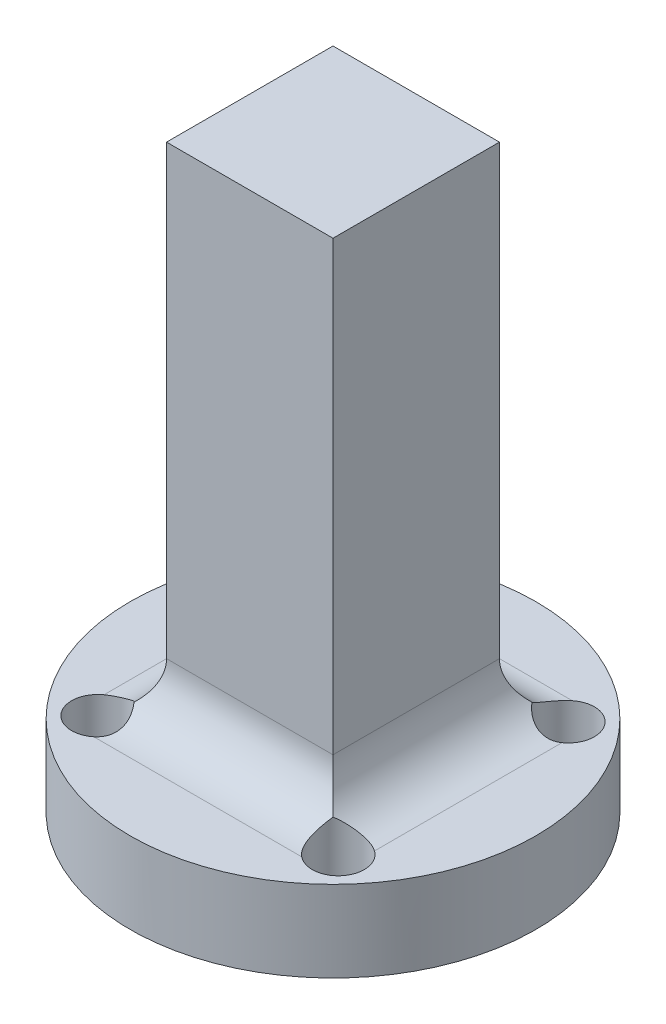
from build123d import *

# Parameters (mm, degrees)
SKETCH1_R           = 9.75
SKETCH1_R_2         = 1.25
BOSS_EXTRUDE2_DEPTH = 2
SKETCH2_W           = 8
SKETCH2_H           = 8
BOSS_EXTRUDE3_DEPTH = 24
BOSS_EXTRUDE5_START = 1.9
SKETCH7_R           = 9.75
SKETCH7_R_2         = 4.5
SKETCH7_R_3         = 1.25
BOSS_EXTRUDE5_DEPTH = 1.9
FILLET1_R           = 2.5


with BuildPart() as part:
    # Sketch1 → Boss-Extrude2 (new body)
    with BuildSketch(Plane(origin=(0, 0, 0), x_dir=(1, 0, 0), z_dir=(0, 1, 0))):
        with Locations(Location((0, 0, 0), (0, 0, 270))):
            Circle(SKETCH1_R)
        with Locations(Location((-5.78230038, 5.52856241, 0), (0, 0, 270))):
            Circle(SKETCH1_R_2, mode=Mode.SUBTRACT)
        with Locations(Location((-5.78230038, -5.52856241, 0), (0, 0, 270))):
            Circle(SKETCH1_R_2, mode=Mode.SUBTRACT)
        with Locations(Location((5.78230038, -5.52856241, 0), (0, 0, 270))):
            Circle(SKETCH1_R_2, mode=Mode.SUBTRACT)
        with Locations(Location((5.78230038, 5.52856241, 0), (0, 0, 270))):
            Circle(SKETCH1_R_2, mode=Mode.SUBTRACT)
    extrude(amount=BOSS_EXTRUDE2_DEPTH)

    # Sketch2 → Boss-Extrude3 (add)
    with BuildSketch(Plane(origin=(0, 2, 0), x_dir=(1, 0, 0), z_dir=(0, 1, 0))):
        Rectangle(SKETCH2_W, SKETCH2_H)
    extrude(amount=BOSS_EXTRUDE3_DEPTH)

    # Sketch7 → Boss-Extrude5 (add)
    with BuildSketch(Plane.XZ.offset(BOSS_EXTRUDE5_START)):
        with Locations(Location((0, 0, 0), (0, 0, 270))):
            Circle(SKETCH7_R)
        with Locations(Location((0, 0, 0), (0, 0, 90))):
            Circle(SKETCH7_R_2, mode=Mode.SUBTRACT)
        with Locations(Location((-5.78230038, 5.52856241, 0), (0, 0, 270))):
            Circle(SKETCH7_R_3, mode=Mode.SUBTRACT)
        with Locations(Location((5.78230038, 5.52856241, 0), (0, 0, 270))):
            Circle(SKETCH7_R_3, mode=Mode.SUBTRACT)
        with Locations(Location((5.78230038, -5.52856241, 0), (0, 0, 270))):
            Circle(SKETCH7_R_3, mode=Mode.SUBTRACT)
        with Locations(Location((-5.78230038, -5.52856241, 0), (0, 0, 270))):
            Circle(SKETCH7_R_3, mode=Mode.SUBTRACT)
    extrude(amount=-BOSS_EXTRUDE5_DEPTH)

    # Fillet1
    # the kernel refuses this fillet: 2.5 mm, written as the material it adds along each edge
    with BuildSketch(Plane(origin=(4, 2, -4), x_dir=(1, 0, 0), z_dir=(0, 0, 1)), Plane(origin=(-4, 2, -4), x_dir=(0, 0, -1), z_dir=(1, 0, 0)), Plane(origin=(4, 2, 4), x_dir=(0, 0, 1), z_dir=(-1, 0, 0)), Plane(origin=(-4, 2, 4), x_dir=(-1, 0, 0), z_dir=(0, 0, -1))) as fillet1_piece_1:
        with BuildLine():
            CenterArc((FILLET1_R, FILLET1_R), FILLET1_R, 180, 90)
            Line((0, FILLET1_R), (0, 0))
            Line((0, 0), (FILLET1_R, 0))
        make_face()
    extrude(amount=8)
    with BuildSketch(Plane(origin=(4, 2, -10.25), x_dir=(1, 0, 0), z_dir=(0, 0, 1))) as fillet1_piece_2a_section:
        with BuildLine():
            CenterArc((FILLET1_R, FILLET1_R), FILLET1_R, 180, 90)
            Line((0, FILLET1_R), (0, 0))
            Line((0, 0), (FILLET1_R, 0))
        make_face()
    fillet1_piece_2a = extrude(amount=14.25, mode=Mode.PRIVATE)
    fillet1_piece_2a = fillet1_piece_2a & Plane(origin=(0, 2.663763666, 0), x_dir=(0, 0, 1), z_dir=(0, -1, 0)) * Cylinder(9.75, 39, mode=Mode.PRIVATE)
    fillet1_piece_2a = fillet1_piece_2a - Plane(origin=(5.78230038, 2.663763666, -5.52856241), x_dir=(0, 0, 1), z_dir=(0, -1, 0)) * Cylinder(1.25, 39, mode=Mode.PRIVATE)
    fillet1_piece_2a = split(fillet1_piece_2a, bisect_by=Plane(origin=(4.398974619, 2.663763666, -4), z_dir=(0, 0, -1)), keep=Keep.TOP, mode=Mode.PRIVATE)
    with BuildSketch(Plane(origin=(-4, 2, -4), x_dir=(0, 0, -1), z_dir=(1, 0, 0))) as fillet1_piece_2b_section:
        with BuildLine():
            CenterArc((FILLET1_R, FILLET1_R), FILLET1_R, 180, 90)
            Line((0, FILLET1_R), (0, 0))
            Line((0, 0), (FILLET1_R, 0))
        make_face()
    fillet1_piece_2b = extrude(amount=14.25, mode=Mode.PRIVATE)
    fillet1_piece_2b = fillet1_piece_2b & Plane(origin=(0, 2.68491829, 0), x_dir=(0, 0, 1), z_dir=(0, -1, 0)) * Cylinder(9.75, 39, mode=Mode.PRIVATE)
    fillet1_piece_2b = fillet1_piece_2b - Plane(origin=(5.78230038, 2.68491829, -5.52856241), x_dir=(0, 0, 1), z_dir=(0, -1, 0)) * Cylinder(1.25, 39, mode=Mode.PRIVATE)
    fillet1_piece_2b = split(fillet1_piece_2b, bisect_by=Plane(origin=(4, 2.68491829, -4.384125447), z_dir=(1, 0, 0)), keep=Keep.TOP, mode=Mode.PRIVATE)
    fillet1_piece_2 = fillet1_piece_2a & fillet1_piece_2b
    add(fillet1_piece_2)
    with BuildSketch(Plane(origin=(10.25, 2, 4), x_dir=(0, 0, 1), z_dir=(-1, 0, 0))) as fillet1_piece_3a_section:
        with BuildLine():
            CenterArc((FILLET1_R, FILLET1_R), FILLET1_R, 180, 90)
            Line((0, FILLET1_R), (0, 0))
            Line((0, 0), (FILLET1_R, 0))
        make_face()
    fillet1_piece_3a = extrude(amount=14.25, mode=Mode.PRIVATE)
    fillet1_piece_3a = fillet1_piece_3a & Plane(origin=(0, 2.684921118, 0), x_dir=(0, 0, 1), z_dir=(0, -1, 0)) * Cylinder(9.75, 39, mode=Mode.PRIVATE)
    fillet1_piece_3a = fillet1_piece_3a - Plane(origin=(5.78230038, 2.684921118, 5.52856241), x_dir=(0, 0, 1), z_dir=(0, -1, 0)) * Cylinder(1.25, 39, mode=Mode.PRIVATE)
    fillet1_piece_3a = split(fillet1_piece_3a, bisect_by=Plane(origin=(4, 2.684921118, 4.384140978), z_dir=(1, 0, 0)), keep=Keep.TOP, mode=Mode.PRIVATE)
    with BuildSketch(Plane(origin=(4, 2, -4), x_dir=(1, 0, 0), z_dir=(0, 0, 1))) as fillet1_piece_3b_section:
        with BuildLine():
            CenterArc((FILLET1_R, FILLET1_R), FILLET1_R, 180, 90)
            Line((0, FILLET1_R), (0, 0))
            Line((0, 0), (FILLET1_R, 0))
        make_face()
    fillet1_piece_3b = extrude(amount=14.25, mode=Mode.PRIVATE)
    fillet1_piece_3b = fillet1_piece_3b & Plane(origin=(0, 2.663763629, 0), x_dir=(0, 0, 1), z_dir=(0, -1, 0)) * Cylinder(9.75, 39, mode=Mode.PRIVATE)
    fillet1_piece_3b = fillet1_piece_3b - Plane(origin=(5.78230038, 2.663763629, 5.52856241), x_dir=(0, 0, 1), z_dir=(0, -1, 0)) * Cylinder(1.25, 39, mode=Mode.PRIVATE)
    fillet1_piece_3b = split(fillet1_piece_3b, bisect_by=Plane(origin=(4.398975598, 2.663763629, 4), z_dir=(0, 0, 1)), keep=Keep.TOP, mode=Mode.PRIVATE)
    fillet1_piece_3 = fillet1_piece_3a & fillet1_piece_3b
    add(fillet1_piece_3)
    with BuildSketch(Plane(origin=(-4, 2, 4), x_dir=(-1, 0, 0), z_dir=(0, 0, -1))) as fillet1_piece_4a_section:
        with BuildLine():
            CenterArc((FILLET1_R, FILLET1_R), FILLET1_R, 180, 90)
            Line((0, FILLET1_R), (0, 0))
            Line((0, 0), (FILLET1_R, 0))
        make_face()
    fillet1_piece_4a = extrude(amount=14.25, mode=Mode.PRIVATE)
    fillet1_piece_4a = fillet1_piece_4a & Plane(origin=(0, 2.663765474, 0), x_dir=(0, 0, 1), z_dir=(0, -1, 0)) * Cylinder(9.75, 39, mode=Mode.PRIVATE)
    fillet1_piece_4a = fillet1_piece_4a - Plane(origin=(-5.78230038, 2.663765474, -5.52856241), x_dir=(0, 0, 1), z_dir=(0, -1, 0)) * Cylinder(1.25, 39, mode=Mode.PRIVATE)
    fillet1_piece_4a = split(fillet1_piece_4a, bisect_by=Plane(origin=(-4.39896904, 2.663765474, -4), z_dir=(0, 0, -1)), keep=Keep.TOP, mode=Mode.PRIVATE)
    with BuildSketch(Plane(origin=(-10.25, 2, -4), x_dir=(0, 0, -1), z_dir=(1, 0, 0))) as fillet1_piece_4b_section:
        with BuildLine():
            CenterArc((FILLET1_R, FILLET1_R), FILLET1_R, 180, 90)
            Line((0, FILLET1_R), (0, 0))
            Line((0, 0), (FILLET1_R, 0))
        make_face()
    fillet1_piece_4b = extrude(amount=14.25, mode=Mode.PRIVATE)
    fillet1_piece_4b = fillet1_piece_4b & Plane(origin=(0, 2.684918127, 0), x_dir=(0, 0, 1), z_dir=(0, -1, 0)) * Cylinder(9.75, 39, mode=Mode.PRIVATE)
    fillet1_piece_4b = fillet1_piece_4b - Plane(origin=(-5.78230038, 2.684918127, -5.52856241), x_dir=(0, 0, 1), z_dir=(0, -1, 0)) * Cylinder(1.25, 39, mode=Mode.PRIVATE)
    fillet1_piece_4b = split(fillet1_piece_4b, bisect_by=Plane(origin=(-4, 2.684918127, -4.384124985), z_dir=(-1, 0, 0)), keep=Keep.TOP, mode=Mode.PRIVATE)
    fillet1_piece_4 = fillet1_piece_4a & fillet1_piece_4b
    add(fillet1_piece_4)
    with BuildSketch(Plane(origin=(-4, 2, 10.25), x_dir=(-1, 0, 0), z_dir=(0, 0, -1))) as fillet1_piece_5a_section:
        with BuildLine():
            CenterArc((FILLET1_R, FILLET1_R), FILLET1_R, 180, 90)
            Line((0, FILLET1_R), (0, 0))
            Line((0, 0), (FILLET1_R, 0))
        make_face()
    fillet1_piece_5a = extrude(amount=14.25, mode=Mode.PRIVATE)
    fillet1_piece_5a = fillet1_piece_5a & Plane(origin=(0, 2.66376539, 0), x_dir=(0, 0, 1), z_dir=(0, -1, 0)) * Cylinder(9.75, 39, mode=Mode.PRIVATE)
    fillet1_piece_5a = fillet1_piece_5a - Plane(origin=(-5.78230038, 2.66376539, 5.52856241), x_dir=(0, 0, 1), z_dir=(0, -1, 0)) * Cylinder(1.25, 39, mode=Mode.PRIVATE)
    fillet1_piece_5a = split(fillet1_piece_5a, bisect_by=Plane(origin=(-4.398969268, 2.66376539, 4), z_dir=(0, 0, 1)), keep=Keep.TOP, mode=Mode.PRIVATE)
    with BuildSketch(Plane(origin=(4, 2, 4), x_dir=(0, 0, 1), z_dir=(-1, 0, 0))) as fillet1_piece_5b_section:
        with BuildLine():
            CenterArc((FILLET1_R, FILLET1_R), FILLET1_R, 180, 90)
            Line((0, FILLET1_R), (0, 0))
            Line((0, 0), (FILLET1_R, 0))
        make_face()
    fillet1_piece_5b = extrude(amount=14.25, mode=Mode.PRIVATE)
    fillet1_piece_5b = fillet1_piece_5b & Plane(origin=(0, 2.684921922, 0), x_dir=(0, 0, 1), z_dir=(0, -1, 0)) * Cylinder(9.75, 39, mode=Mode.PRIVATE)
    fillet1_piece_5b = fillet1_piece_5b - Plane(origin=(-5.78230038, 2.684921922, 5.52856241), x_dir=(0, 0, 1), z_dir=(0, -1, 0)) * Cylinder(1.25, 39, mode=Mode.PRIVATE)
    fillet1_piece_5b = split(fillet1_piece_5b, bisect_by=Plane(origin=(-4, 2.684921922, 4.384144633), z_dir=(-1, 0, 0)), keep=Keep.TOP, mode=Mode.PRIVATE)
    fillet1_piece_5 = fillet1_piece_5a & fillet1_piece_5b
    add(fillet1_piece_5)


solid = part.part
